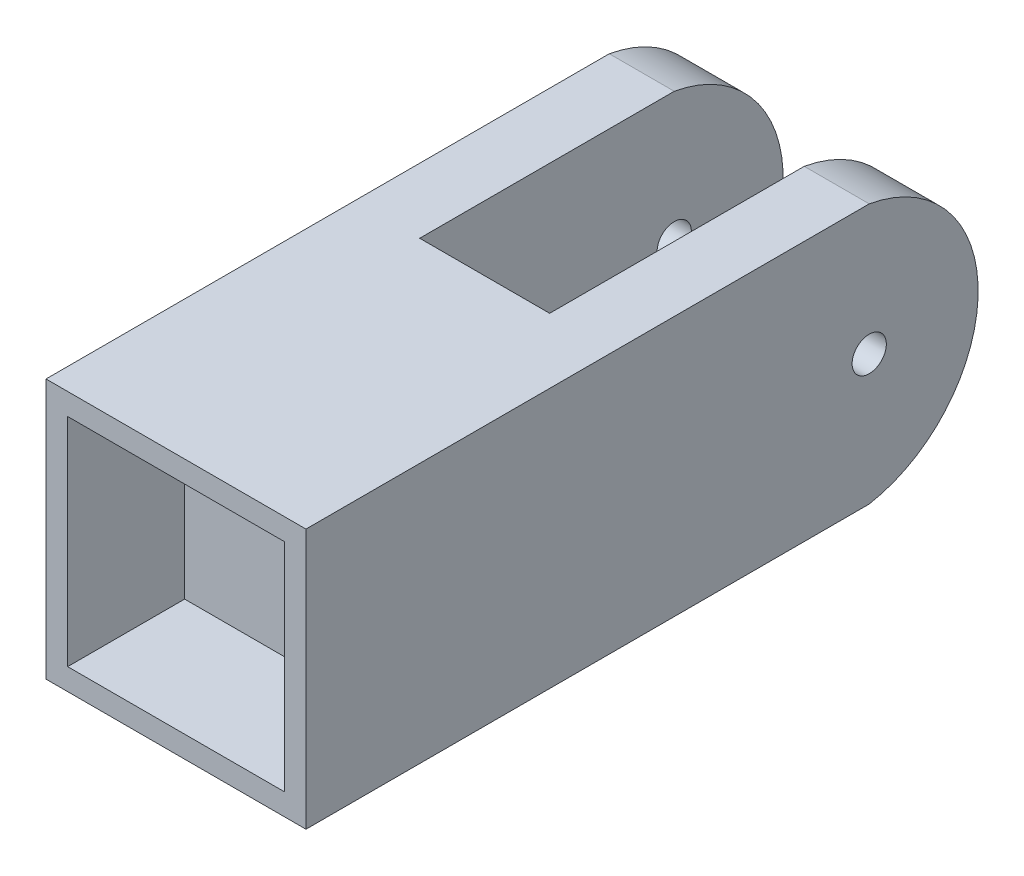
from build123d import *

# Parameters (mm, degrees)
SKETCH2_W           = 60
SKETCH2_H           = 60
BOSS_EXTRUDE1_DEPTH = 100
SKETCH3_W           = 15
SKETCH3_H           = 60
BOSS_EXTRUDE2_DEPTH = 30
BOSS_EXTRUDE3_DEPTH = 15
BOSS_EXTRUDE4_START = -15
BOSS_EXTRUDE4_DEPTH = 15
SKETCH6_W           = 50
SKETCH6_H           = 50
CUT_EXTRUDE1_DEPTH  = 27
SKETCH7_R           = 3.95
CUT_EXTRUDE2_DEPTH  = 114.688170009
SKETCH9_R           = 3.95
CUT_EXTRUDE3_DEPTH  = 114.688170009
CUT_EXTRUDE4_DEPTH  = 30
FILLET1_R           = 5


with BuildPart() as part:
    # Sketch2 → Boss-Extrude1 (new body)
    with BuildSketch(Plane.XY):
        Rectangle(SKETCH2_W, SKETCH2_H)
    extrude(amount=BOSS_EXTRUDE1_DEPTH)

    # Sketch3 → Boss-Extrude2 (add)
    with BuildSketch(Plane(origin=(0, 0, 0), x_dir=(-1, 0, 0), z_dir=(0, 0, -1))):
        with Locations((22.5, 0)):
            Rectangle(SKETCH3_W, SKETCH3_H)
        with Locations((-22.5, 0)):
            Rectangle(SKETCH3_W, SKETCH3_H)
    extrude(amount=BOSS_EXTRUDE2_DEPTH)

    # Sketch4 → Boss-Extrude3 (add)
    with BuildSketch(Plane.ZY.offset(30)):
        with BuildLine():
            Line((-30, -30), (-30, 30))
            ThreePointArc((-30, 30), (-55.138874415, 0), (-30, -30))
        make_face()
    extrude(amount=-BOSS_EXTRUDE3_DEPTH)

    # Sketch5 → Boss-Extrude4 (add)
    with BuildSketch(Plane(origin=(30, 0, 0), x_dir=(0, 0, -1), z_dir=(1, 0, 0)).offset(BOSS_EXTRUDE4_START)):
        with BuildLine():
            Line((30, 30), (30, -30))
            ThreePointArc((30, -30), (55.138874415, 0), (30, 30))
        make_face()
    extrude(amount=BOSS_EXTRUDE4_DEPTH)

    # Sketch6 → Cut-Extrude1 (cut)
    with BuildSketch(Plane.XY.offset(100)):
        Rectangle(SKETCH6_W, SKETCH6_H)
    extrude(amount=-CUT_EXTRUDE1_DEPTH, mode=Mode.SUBTRACT)

    # Sketch7 → Cut-Extrude2 (cut, through all)
    with BuildSketch(Plane.ZY.offset(-15)):
        with Locations((-30, 0)):
            Circle(SKETCH7_R)
    extrude(amount=-CUT_EXTRUDE2_DEPTH, mode=Mode.SUBTRACT)

    # Sketch9 → Cut-Extrude3 (cut, through all)
    with BuildSketch(Plane(origin=(-15, 0, 0), x_dir=(0, 0, -1), z_dir=(1, 0, 0))):
        with Locations((30, 0)):
            Circle(SKETCH9_R)
    extrude(amount=-CUT_EXTRUDE3_DEPTH, mode=Mode.SUBTRACT)

    # Sketch12 → Cut-Extrude4 (cut)
    with BuildSketch(Plane(origin=(-15, 0, 0), x_dir=(0, 0, -1), z_dir=(1, 0, 0))):
        Polygon((-28.753793558, 30), (0, 0), (0, 30), align=None)
        Polygon((0, -30), (0, 0), (-28.753793558, -30), align=None)
    extrude(amount=CUT_EXTRUDE4_DEPTH, mode=Mode.SUBTRACT)

    # Fillet1
    fillet1_edges = [part.edges().sort_by_distance(p)[0] for p in [
        (0, 0, 0),
    ]]
    fillet(fillet1_edges, radius=FILLET1_R)


solid = part.part
